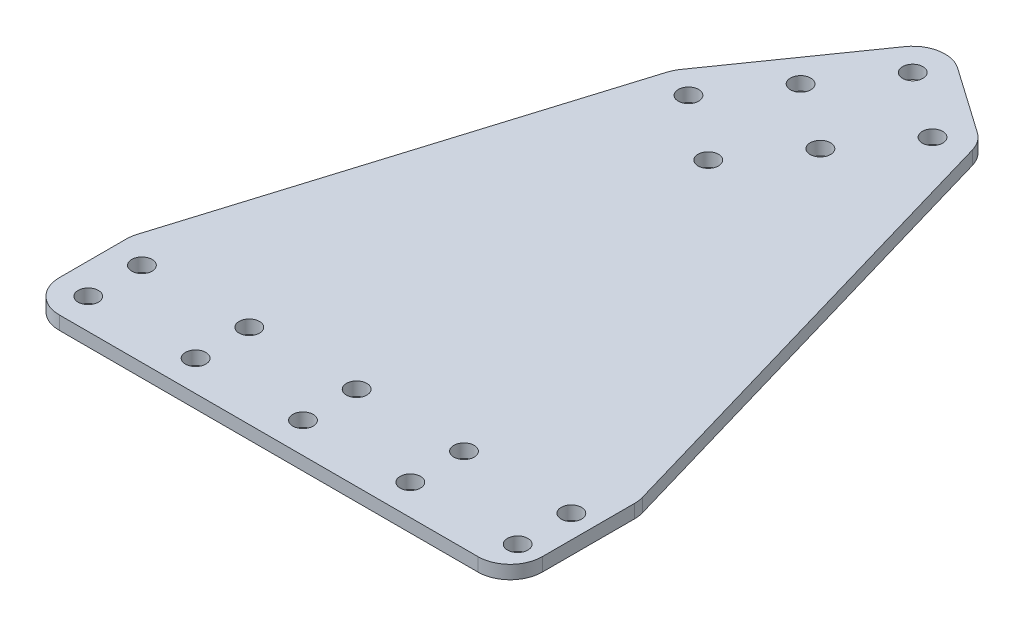
from build123d import *

# Parameters (mm, degrees)
SKETCH1_W           = 114.3
SKETCH1_H           = 181.61
BOSS_EXTRUDE1_DEPTH = 3.175
SKETCH2_R           = 2.413
CUT_EXTRUDE1_DEPTH  = 215.608393883
SKETCH3_R           = 2.413
CUT_EXTRUDE2_DEPTH  = 215.608393883
CUT_EXTRUDE3_DEPTH  = 215.608393883
FILLET1_R           = 7.62


with BuildPart() as part:
    # Sketch1 → Boss-Extrude1 (new body)
    with BuildSketch(Plane(origin=(0, 0, 0), x_dir=(1, 0, 0), z_dir=(0, 1, 0))):
        with Locations((57.15, 90.805)):
            Rectangle(SKETCH1_W, SKETCH1_H)
    extrude(amount=BOSS_EXTRUDE1_DEPTH)

    # Sketch2 → Cut-Extrude1 (cut, through all)
    with BuildSketch(Plane(origin=(0, 3.175, 0), x_dir=(1, 0, 0), z_dir=(0, 1, 0))):
        with Locations((7.239, 7.239)):
            Circle(SKETCH2_R)
        with Locations((7.239, 19.939)):
            Circle(SKETCH2_R)
        with Locations((32.639, 19.939)):
            Circle(SKETCH2_R)
        with Locations((58.039, 19.939)):
            Circle(SKETCH2_R)
        with Locations((83.439, 19.939)):
            Circle(SKETCH2_R)
        with Locations((108.839, 19.939)):
            Circle(SKETCH2_R)
        with Locations((32.639, 7.239)):
            Circle(SKETCH2_R)
        with Locations((58.039, 7.239)):
            Circle(SKETCH2_R)
        with Locations((83.439, 7.239)):
            Circle(SKETCH2_R)
        with Locations((108.839, 7.239)):
            Circle(SKETCH2_R)
    extrude(amount=-CUT_EXTRUDE1_DEPTH, mode=Mode.SUBTRACT)

    # Sketch3 → Cut-Extrude2 (cut, through all)
    with BuildSketch(Plane.XZ):
        with Locations((37.069991282, -119.411511373)):
            Circle(SKETCH3_R)
        with Locations((52.674837726, -108.48488026)):
            Circle(SKETCH3_R)
        with Locations((74.52809995, -139.694573148)):
            Circle(SKETCH3_R)
        with Locations((58.923253507, -150.62120426)):
            Circle(SKETCH3_R)
        with Locations((47.996622394, -135.016357816)):
            Circle(SKETCH3_R)
        with Locations((63.601468838, -124.089726704)):
            Circle(SKETCH3_R)
    extrude(amount=-CUT_EXTRUDE2_DEPTH, mode=Mode.SUBTRACT)

    # Sketch4 → Cut-Extrude3 (cut, through all)
    with BuildSketch(Plane.XZ):
        Polygon((57.051967374, -161.233795283), (30.138346742, -122.797161623), (0, -24.616986592), (0, -181.61), (114.3, -181.61), (114.3, -30.54568675), (81.093220618, -144.399928534), align=None)
    extrude(amount=-CUT_EXTRUDE3_DEPTH, mode=Mode.SUBTRACT)

    # Fillet1
    fillet1_edges = [part.edges().sort_by_distance(p)[0] for p in [
        (114.3, 1.5875, -30.54568675),
        (0, 1.5875, -24.616986592),
        (30.138346742, 1.5875, -122.797161623),
        (57.051967374, 1.5875, -161.233795283),
        (81.093220618, 1.5875, -144.399928534),
        (0, 1.5875, 0),
        (114.3, 1.5875, 0),
    ]]
    fillet(fillet1_edges, radius=FILLET1_R)


solid = part.part
